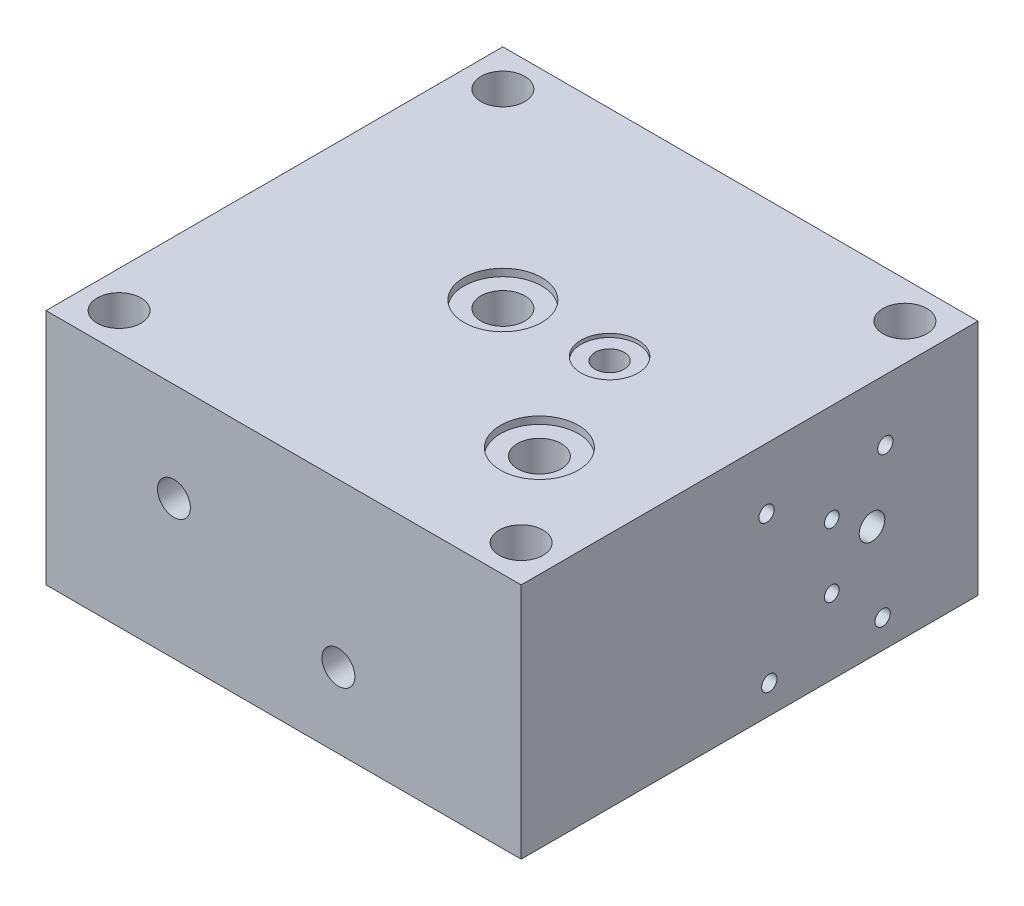
from build123d import *

# Parameters (mm, degrees)
SKETCH_2_W                 = 130
SKETCH_2_H                 = 125
SKETCH_2_R                 = 6
EXTRUDE_1_DEPTH            = 65
HOLE_WIZARD_4_0_4_5_D      = 4
HOLE_WIZARD_M5_3_D         = 4.2
HOLE_WIZARD_M5_3_DEPTH     = 12
HOLE_WIZARD_M5_3_TIP       = 1.2618073
HOLE_WIZARD_4_0_4_9_D      = 4
HOLE_WIZARD_4_0_4_9_DEPTH  = 32.5
HOLE_WIZARD_4_0_4_9_TIP    = 1.201721238
HOLE_WIZARD_6_0_6_1_D      = 6
HOLE_WIZARD_6_0_6_1_DEPTH  = 42
HOLE_WIZARD_6_0_6_1_TIP    = 1.802581857
HOLE_WIZARD_M6_1_D         = 5
HOLE_WIZARD_M6_1_DEPTH     = 13
HOLE_WIZARD_M6_1_TIP       = 1.502151548
HOLE_WIZARD_4_0_4_11_D     = 4
HOLE_WIZARD_4_0_4_11_DEPTH = 85
HOLE_WIZARD_4_0_4_11_TIP   = 1.201721238
M10X1_0_1_D                = 9
M10X1_0_1_DEPTH            = 13
M10X1_0_1_TIP              = 2.703872786
HOLE_WIZARD_8_0_8_1_D      = 8
HOLE_WIZARD_M5_5_D         = 4.2
HOLE_WIZARD_M5_5_DEPTH     = 10
HOLE_WIZARD_M5_5_TIP       = 1.2618073
HOLE_WIZARD_6_0_6_2_D      = 6
HOLE_WIZARD_6_0_6_2_DEPTH  = 58.5
HOLE_WIZARD_6_0_6_2_TIP    = 1.802581857
HOLE_WIZARD_6_0_6_3_D      = 6
HOLE_WIZARD_6_0_6_3_DEPTH  = 31
HOLE_WIZARD_6_0_6_3_TIP    = 1.802581857
HOLE_WIZARD_6_0_6_4_D      = 6
M10X1_0_2_D                = 9
M10X1_0_2_DEPTH            = 13
M10X1_0_2_TIP              = 2.703872786
SKETCH_67_R                = 10.65
CUT_EXTRUDE_1_DEPTH        = 2
MM_1_D                     = 12
MM_5_D                     = 6
MM_5_DEPTH                 = 41.31
MM_5_TIP                   = 1.802581857
SKETCH_72_R                = 7.8
CUT_EXTRUDE_2_DEPTH        = 1
MM_4_D                     = 6
MM_4_DEPTH                 = 38
MM_4_TIP                   = 1.802581857
M8X1_0_1_D                 = 7
M8X1_0_1_DEPTH             = 10
M8X1_0_1_TIP               = 2.103012167
SKETCH_77_R                = 4
CUT_EXTRUDE_3_DEPTH        = 2


# Read off the part's stored shape, not the designer's step: 大小mm 暗销孔3
with BuildPart() as part:
    # 草图2 → 凸台-拉伸1 (new body)
    with BuildSketch(Plane(origin=(0, 0, 0), x_dir=(1, 0, 0), z_dir=(0, 1, 0))):
        Rectangle(SKETCH_2_W, SKETCH_2_H)
        with Locations(Location((-55, 52.5, 0), (0, 0, 270))):
            Circle(SKETCH_2_R, mode=Mode.SUBTRACT)
        with Locations(Location((55, 52.5, 0), (0, 0, 270))):
            Circle(SKETCH_2_R, mode=Mode.SUBTRACT)
        with Locations(Location((55, -52.5, 0), (0, 0, 270))):
            Circle(SKETCH_2_R, mode=Mode.SUBTRACT)
        with Locations(Location((-55, -52.5, 0), (0, 0, 270))):
            Circle(SKETCH_2_R, mode=Mode.SUBTRACT)
    extrude(amount=EXTRUDE_1_DEPTH)

    # Ø4.0 (4) 直径孔5 (through all)
    with Locations(Plane(origin=(-65, 38, -22.5), x_dir=(0, 0, -1), z_dir=(-1, 0, 0))):
        with Locations((0, 0)):
            Hole(HOLE_WIZARD_4_0_4_5_D / 2)

    # M5 螺纹孔3
    with Locations(Plane(origin=(65, 48.3, -4.65), x_dir=(0, 0, 1), z_dir=(1, 0, 0))):
        with Locations((0, 0), (-32.5, 0), (-31.75, 40.5), (-0.75, 40.5)):
            Hole(HOLE_WIZARD_M5_3_D / 2, depth=HOLE_WIZARD_M5_3_DEPTH)
            with Locations((0, 0, -(HOLE_WIZARD_M5_3_DEPTH + HOLE_WIZARD_M5_3_TIP / 2))):  # 118° drill point
                Cone(0, HOLE_WIZARD_M5_3_D / 2, HOLE_WIZARD_M5_3_TIP, mode=Mode.SUBTRACT)

    # Ø4.0 (4) 直径孔9
    with Locations(Plane(origin=(65, 20.5, -22.49541266), x_dir=(0, 0, 1), z_dir=(1, 0, 0))):
        with Locations((0, 0)):
            Hole(HOLE_WIZARD_4_0_4_9_D / 2, depth=HOLE_WIZARD_4_0_4_9_DEPTH)
            with Locations((0, 0, -(HOLE_WIZARD_4_0_4_9_DEPTH + HOLE_WIZARD_4_0_4_9_TIP / 2))):  # 118° drill point
                Cone(0, HOLE_WIZARD_4_0_4_9_D / 2, HOLE_WIZARD_4_0_4_9_TIP, mode=Mode.SUBTRACT)

    # Ø6.0 (6) 直径孔1
    with Locations(Plane(origin=(32.5, 20.5, -62.5), x_dir=(-1, 0, 0), z_dir=(0, 0, -1))):
        with Locations((0, 0)):
            Hole(HOLE_WIZARD_6_0_6_1_D / 2, depth=HOLE_WIZARD_6_0_6_1_DEPTH)
            with Locations((0, 0, -(HOLE_WIZARD_6_0_6_1_DEPTH + HOLE_WIZARD_6_0_6_1_TIP / 2))):  # 118° drill point
                Cone(0, HOLE_WIZARD_6_0_6_1_D / 2, HOLE_WIZARD_6_0_6_1_TIP, mode=Mode.SUBTRACT)

    # M6 螺纹孔1
    with Locations(Plane(origin=(-65, 52.5, -37), x_dir=(0, 0, -1), z_dir=(-1, 0, 0))):
        with Locations((0, 0), (-29, 0), (0, 29), (-29, 29)):
            Hole(HOLE_WIZARD_M6_1_D / 2, depth=HOLE_WIZARD_M6_1_DEPTH)
            with Locations((0, 0, -(HOLE_WIZARD_M6_1_DEPTH + HOLE_WIZARD_M6_1_TIP / 2))):  # 118° drill point
                Cone(0, HOLE_WIZARD_M6_1_D / 2, HOLE_WIZARD_M6_1_TIP, mode=Mode.SUBTRACT)

    # Ø4.0 (4) 直径孔11
    with Locations(Plane(origin=(-30, 38, 62.5), x_dir=(1, 0, 0), z_dir=(0, 0, 1))):
        with Locations((0, 0)):
            Hole(HOLE_WIZARD_4_0_4_11_D / 2, depth=HOLE_WIZARD_4_0_4_11_DEPTH)
            with Locations((0, 0, -(HOLE_WIZARD_4_0_4_11_DEPTH + HOLE_WIZARD_4_0_4_11_TIP / 2))):  # 118° drill point
                Cone(0, HOLE_WIZARD_4_0_4_11_D / 2, HOLE_WIZARD_4_0_4_11_TIP, mode=Mode.SUBTRACT)

    # M10x1.0 螺纹孔1
    with Locations(Plane(origin=(-30, 38, 62.5), x_dir=(1, 0, 0), z_dir=(0, 0, 1))):
        with Locations((0, 0)):
            Hole(M10X1_0_1_D / 2, depth=M10X1_0_1_DEPTH)
            with Locations((0, 0, -(M10X1_0_1_DEPTH + M10X1_0_1_TIP / 2))):  # 118° drill point
                Cone(0, M10X1_0_1_D / 2, M10X1_0_1_TIP, mode=Mode.SUBTRACT)

    # Ø8.0 (8) 直径孔1 (through all)
    with Locations(Plane(origin=(23, 0, -3.7), x_dir=(0, 0, -1), z_dir=(0, -1, 0))):
        with Locations((0, 0)):
            Hole(HOLE_WIZARD_8_0_8_1_D / 2)

    # M5 螺纹孔5
    with Locations(Plane(origin=(4.7, 36, -62.5), x_dir=(-1, 0, 0), z_dir=(0, 0, -1))):
        with Locations((0, 0), (-40.5, 0), (-40.5, -31), (0, -31)):
            Hole(HOLE_WIZARD_M5_5_D / 2, depth=HOLE_WIZARD_M5_5_DEPTH)
            with Locations((0, 0, -(HOLE_WIZARD_M5_5_DEPTH + HOLE_WIZARD_M5_5_TIP / 2))):  # 118° drill point
                Cone(0, HOLE_WIZARD_M5_5_D / 2, HOLE_WIZARD_M5_5_TIP, mode=Mode.SUBTRACT)

    # Ø6.0 (6) 直径孔2
    with Locations(Plane(origin=(23.7, 10.1, -62.5), x_dir=(-1, 0, 0), z_dir=(0, 0, -1))):
        with Locations((0, 0)):
            Hole(HOLE_WIZARD_6_0_6_2_D / 2, depth=HOLE_WIZARD_6_0_6_2_DEPTH)
            with Locations((0, 0, -(HOLE_WIZARD_6_0_6_2_DEPTH + HOLE_WIZARD_6_0_6_2_TIP / 2))):  # 118° drill point
                Cone(0, HOLE_WIZARD_6_0_6_2_D / 2, HOLE_WIZARD_6_0_6_2_TIP, mode=Mode.SUBTRACT)

    # Ø6.0 (6) 直径孔3
    with Locations(Plane(origin=(23.7, 30.9, -62.5), x_dir=(-1, 0, 0), z_dir=(0, 0, -1))):
        with Locations((0, 0)):
            Hole(HOLE_WIZARD_6_0_6_3_D / 2, depth=HOLE_WIZARD_6_0_6_3_DEPTH)
            with Locations((0, 0, -(HOLE_WIZARD_6_0_6_3_DEPTH + HOLE_WIZARD_6_0_6_3_TIP / 2))):  # 118° drill point
                Cone(0, HOLE_WIZARD_6_0_6_3_D / 2, HOLE_WIZARD_6_0_6_3_TIP, mode=Mode.SUBTRACT)

    # Ø6.0 (6) 直径孔4 (through all)
    with Locations(Plane(origin=(15, 20.5, -62.5), x_dir=(-1, 0, 0), z_dir=(0, 0, -1))):
        with Locations((0, 0)):
            Hole(HOLE_WIZARD_6_0_6_4_D / 2)

    # M10x1.0 螺纹孔2
    with Locations(Plane(origin=(15, 20.5, 62.5), x_dir=(1, 0, 0), z_dir=(0, 0, 1))):
        with Locations((0, 0)):
            Hole(M10X1_0_2_D / 2, depth=M10X1_0_2_DEPTH)
            with Locations((0, 0, -(M10X1_0_2_DEPTH + M10X1_0_2_TIP / 2))):  # 118° drill point
                Cone(0, M10X1_0_2_D / 2, M10X1_0_2_TIP, mode=Mode.SUBTRACT)

    # 草图67 → 切除-拉伸1 (cut)
    with BuildSketch(Plane(origin=(0, 65, 0), x_dir=(1, 0, 0), z_dir=(0, 1, 0))):
        with Locations(Location((35, -27.5, 0), (0, 0, 270))):
            Circle(SKETCH_67_R)
        with Locations(Location((-5, 2.5, 0), (0, 0, 270))):
            Circle(SKETCH_67_R)
    extrude(amount=-CUT_EXTRUDE_1_DEPTH, mode=Mode.SUBTRACT)

    # 大小mm 暗销孔1 (through all)
    with Locations(Plane(origin=(35, 63, 27.5), x_dir=(0, 0, 1), z_dir=(0, 1, 0))):
        with Locations((0, 0), (-30, -40)):
            Hole(MM_1_D / 2)

    # 大小mm 暗销孔3 outline → 大小mm 暗销孔3 (revolve, cut)
    with BuildSketch(Plane(origin=(35, 30.9, 0), x_dir=(1, 0, 0), z_dir=(0, -1, 0))):
        Polygon((0, -33.302581857), (3, -31.5), (3, 22.303933481), (0, 22.303933481), align=None)
    revolve(axis=Axis((35, 30.9, 0), (0, 0, 1)), mode=Mode.SUBTRACT)

    # 大小mm 暗销孔5
    with Locations(Plane(origin=(65, 30.8, -33.5), x_dir=(0, 0, 1), z_dir=(1, 0, 0))):
        with Locations((0, 0)):
            Hole(MM_5_D / 2, depth=MM_5_DEPTH)
            with Locations((0, 0, -(MM_5_DEPTH + MM_5_TIP / 2))):  # 118° drill point
                Cone(0, MM_5_D / 2, MM_5_TIP, mode=Mode.SUBTRACT)

    # 草图72 → 切除-拉伸2 (cut)
    with BuildSketch(Plane(origin=(0, 65, 0), x_dir=(1, 0, 0), z_dir=(0, 1, 0))):
        with Locations(Location((23, 3.7, 0), (0, 0, 270))):
            Circle(SKETCH_72_R)
    extrude(amount=-CUT_EXTRUDE_2_DEPTH, mode=Mode.SUBTRACT)

    # 大小mm 暗销孔4
    with Locations(Plane(origin=(0, 0, -62.5), x_dir=(-1, 0, 0), z_dir=(0, 0, -1))):
        with Locations((-35, 30.9)):
            Hole(MM_4_D / 2, depth=MM_4_DEPTH)
            with Locations((0, 0, -(MM_4_DEPTH + MM_4_TIP / 2))):  # 118° drill point
                Cone(0, MM_4_D / 2, MM_4_TIP, mode=Mode.SUBTRACT)

    # M8x1.0 螺纹孔1
    with Locations(Plane(origin=(65, 0, 0), x_dir=(0, 0, -1), z_dir=(1, 0, 0))):
        with Locations((33.5, 30.8)):
            Hole(M8X1_0_1_D / 2, depth=M8X1_0_1_DEPTH)
            with Locations((0, 0, -(M8X1_0_1_DEPTH + M8X1_0_1_TIP / 2))):  # 118° drill point
                Cone(0, M8X1_0_1_D / 2, M8X1_0_1_TIP, mode=Mode.SUBTRACT)

    # 草图77 → 切除-拉伸3 (cut)
    with BuildSketch(Plane(origin=(0, 0, -62.5), x_dir=(-1, 0, 0), z_dir=(0, 0, -1))):
        with Locations((-35, 30.9)):
            Circle(SKETCH_77_R)
    extrude(amount=-CUT_EXTRUDE_3_DEPTH, mode=Mode.SUBTRACT)


solid = part.part
